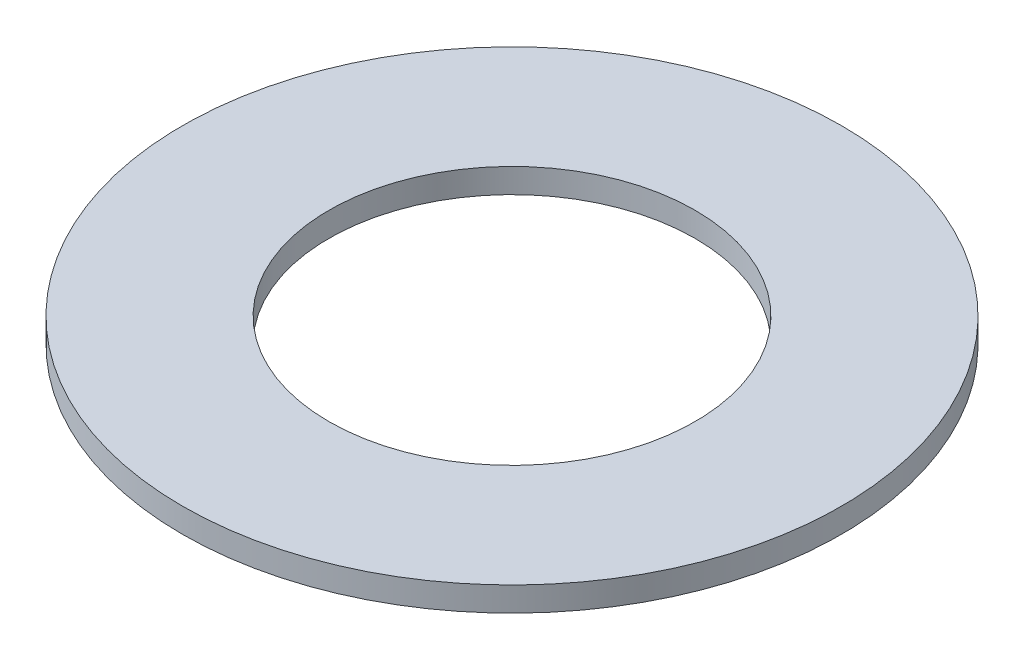
from build123d import *

# Parameters (mm, degrees)
SKETCH1_R               = 13.5
BOSS_EXTRUDE1_DEPTH     = 1
CUT_EXTRUDE3_DEPTH      = 20.118054294
CUT_EXTRUDE3_DEPTH_BACK = 20.118054294
SKETCH4_R               = 7.5


with BuildPart() as part:
    # Sketch1 → Boss-Extrude1 (new body)
    with BuildSketch(Plane(origin=(0, 0, 0), x_dir=(1, 0, 0), z_dir=(0, 1, 0))):
        Circle(SKETCH1_R)
    extrude(amount=BOSS_EXTRUDE1_DEPTH)

    # Sketch4 → Cut-Extrude3 (cut, two sides: drawn at the far end of the back side and taken through both)
    with BuildSketch(Plane(origin=(0, 1, 0), x_dir=(1, 0, 0), z_dir=(0, 1, 0)).offset(-CUT_EXTRUDE3_DEPTH_BACK)):
        Circle(SKETCH4_R)
    extrude(amount=CUT_EXTRUDE3_DEPTH + CUT_EXTRUDE3_DEPTH_BACK, mode=Mode.SUBTRACT)


solid = part.part
